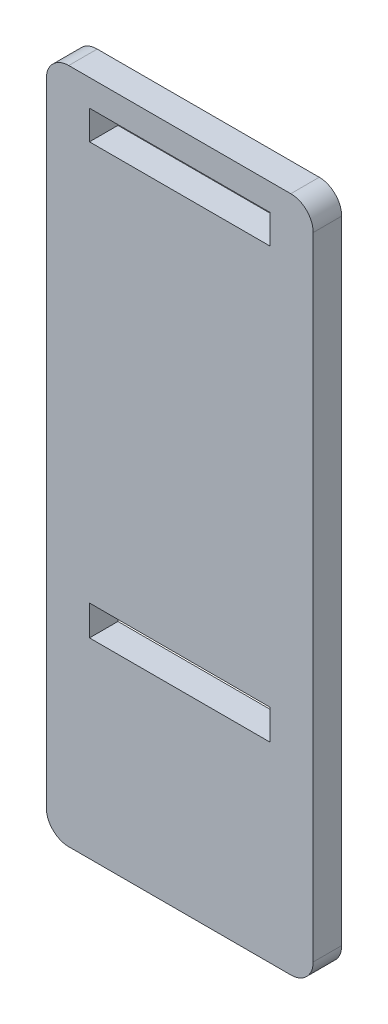
from build123d import *

# Parameters (mm, degrees)
ESBO_O1_W          = 80.5
ESBO_O1_H          = 13
ESBO_O1_H_2        = 13.482318276
FLANGE_BASE1_DEPTH = 12.7


# Sheet-metal steps are written as plain solids
with BuildPart() as part:
    # Esboço1 → Flange-base1 (new body)
    with BuildSketch(Plane.XY):
        with BuildLine():
            Line((-49.5, -150.825), (49.5, -150.825))
            ThreePointArc((49.5, -150.825), (56.571067812, -147.896067812), (59.5, -140.825))
            Line((59.5, -140.825), (59.5, 140.825))
            ThreePointArc((59.5, 140.825), (56.571067812, 147.896067812), (49.5, 150.825))
            Line((49.5, 150.825), (-49.5, 150.825))
            ThreePointArc((-49.5, 150.825), (-56.571067812, 147.896067812), (-59.5, 140.825))
            Line((-59.5, 140.825), (-59.5, -140.825))
            ThreePointArc((-59.5, -140.825), (-56.571067812, -147.896067812), (-49.5, -150.825))
        make_face()
        with Locations((0, 132.475)):
            Rectangle(ESBO_O1_W, ESBO_O1_H, mode=Mode.SUBTRACT)
        with Locations((0, -58.825)):
            Rectangle(ESBO_O1_W, ESBO_O1_H_2, mode=Mode.SUBTRACT)
    extrude(amount=-FLANGE_BASE1_DEPTH)


solid = part.part
